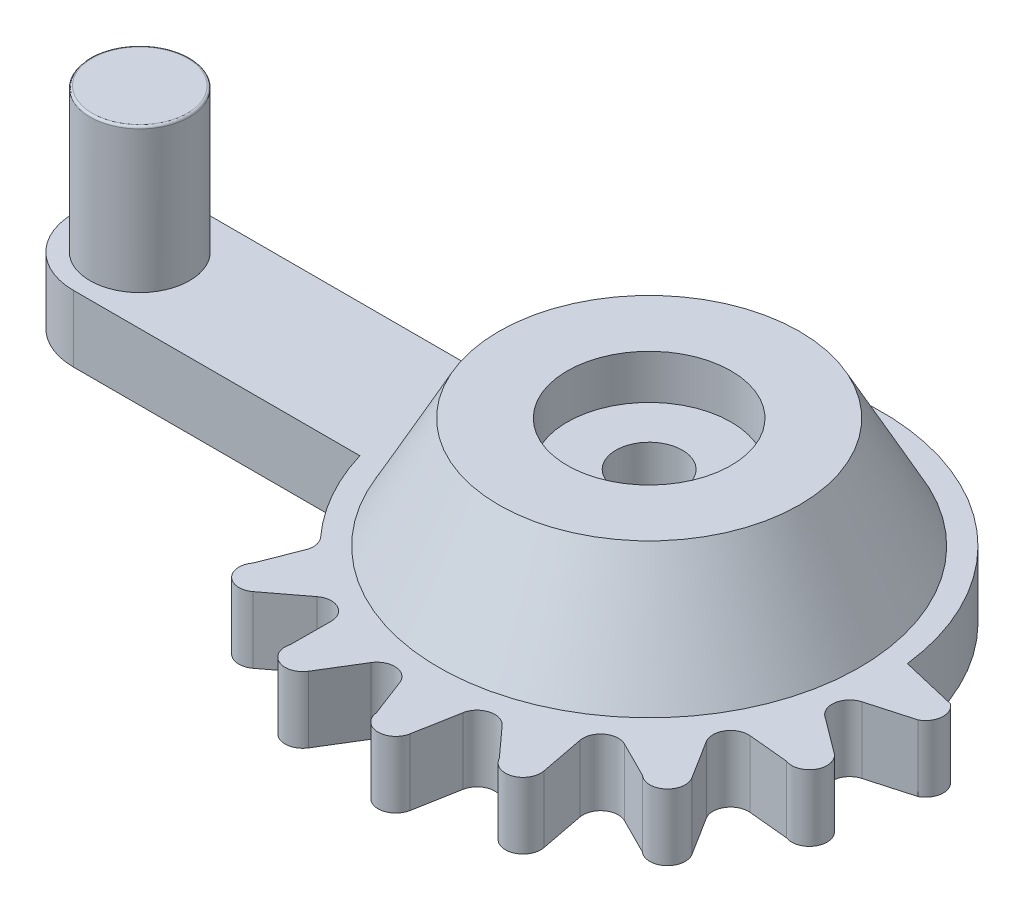
from build123d import *

# Parameters (mm, degrees)
BOSS_EXTRUDE1_DEPTH = 3
BOSS_EXTRUDE2_DEPTH = 3
SKETCH3_R           = 2.25
BOSS_EXTRUDE3_DEPTH = 6.5
FILLET1_R           = 0.1
SKETCH6_R           = 1.5
CUT_EXTRUDE3_DEPTH  = 30.962406787
SKETCH7_R           = 2.25
CUT_EXTRUDE4_DEPTH  = 0.6
SKETCH8_R           = 0.75
CUT_EXTRUDE5_DEPTH  = 7


# Read off the part's stored shape, not the designer's step: Boss-Extrude2
with BuildPart() as part:
    # Sketch1 → Boss-Extrude1 (new body)
    with BuildSketch(Plane(origin=(0, 0, 0), x_dir=(1, 0, 0), z_dir=(0, 1, 0))):
        with BuildLine():
            Line((-23, 3), (-10.062305899, 3))
            ThreePointArc((-10.062305899, 3), (10.5, 0), (-10.062305899, -3))
            Line((-10.062305899, -3), (-23, -3))
            ThreePointArc((-23, -3), (-26, 0), (-23, 3))
        make_face()
    extrude(amount=BOSS_EXTRUDE1_DEPTH)

    # Boss-Extrude2 outline → Boss-Extrude2 (add)
    with BuildSketch(Plane(origin=(0, 0, 0), x_dir=(1, 0, 0), z_dir=(0, 1, 0))):
        with BuildLine():
            ThreePointArc((-5.522818211, -9.478178454), (-5.113524662, -9.318232563), (-4.681499231, -9.398593775))
            ThreePointArc((-4.681499231, -9.398593775), (-6.330495099, -8.377041948), (-7.763435591, -7.069587529))
            ThreePointArc((-7.763435591, -7.069587529), (-7.568178787, -7.463260843), (-7.61030601, -7.900672771))
            Line((-7.61030601, -7.900672771), (-8.279523298, -9.604618361))
            ThreePointArc((-8.279523298, -9.604618361), (-8.203196552, -10.651208986), (-7.156206429, -10.721844617))
            Line((-7.156206429, -10.721844617), (-5.522818211, -9.478178454))
        make_face()
        with BuildLine():
            ThreePointArc((-1.721512659, -10.833918126), (-1.397763446, -10.536788435), (-0.965920838, -10.455476887))
            ThreePointArc((-0.965920838, -10.455476887), (-2.872731946, -10.099376771), (-4.681499231, -9.398593775))
            ThreePointArc((-4.681499231, -9.398593775), (-4.357094721, -9.695015118), (-4.238192033, -10.118058909))
            Line((-4.238192033, -10.118058909), (-4.245930648, -11.948693352))
            ThreePointArc((-4.245930648, -11.948693352), (-3.796296521, -12.896853076), (-2.79461913, -12.584091002))
            Line((-2.79461913, -12.584091002), (-1.721512659, -10.833918126))
        make_face()
        with BuildLine():
            ThreePointArc((2.312803759, -10.723261005), (2.507193937, -10.329163724), (2.880407716, -10.097190272))
            ThreePointArc((2.880407716, -10.097190272), (0.973862068, -10.454740201), (-0.965920838, -10.455476887))
            ThreePointArc((-0.965920838, -10.455476887), (-0.556271486, -10.614522786), (-0.292428604, -10.965941515))
            Line((-0.292428604, -10.965941515), (0.362358895, -12.675484051))
            ThreePointArc((0.362358895, -12.675484051), (1.124441346, -13.396877181), (1.945226568, -12.7430505))
            Line((1.945226568, -12.7430505), (2.312803759, -10.723261005))
        make_face()
        with BuildLine():
            ThreePointArc((6.034076643, -9.161184796), (6.072796451, -8.723461012), (6.336866889, -8.372223004))
            ThreePointArc((6.336866889, -8.372223004), (4.688647545, -9.39502976), (2.880407716, -10.097190272))
            ThreePointArc((2.880407716, -10.097190272), (3.319847778, -10.097333864), (3.692915739, -10.329557645))
            Line((3.692915739, -10.329557645), (4.921602293, -11.686617593))
            ThreePointArc((4.921602293, -11.686617593), (5.892983381, -12.083601839), (6.421781187, -11.177207559))
            Line((6.421781187, -11.177207559), (6.034076643, -9.161184796))
        make_face()
        with BuildLine():
            ThreePointArc((8.938622786, -6.359120261), (8.816430498, -5.937014916), (8.935616531, -5.514050889))
            ThreePointArc((8.935616531, -5.514050889), (7.768814222, -7.063676492), (6.336866889, -8.372223004))
            ThreePointArc((6.336866889, -8.372223004), (6.746618445, -8.213446044), (7.178415082, -8.295043382))
            Line((7.178415082, -8.295043382), (8.814695021, -9.115939424))
            ThreePointArc((8.814695021, -9.115939424), (9.863895986, -9.134782017), (10.029132325, -8.098502778))
            Line((10.029132325, -8.098502778), (8.938622786, -6.359120261))
        make_face()
        with BuildLine():
            ThreePointArc((10.633304904, -2.696333552), (10.366740607, -2.346987899), (10.324902114, -1.909553962))
            ThreePointArc((10.324902114, -1.909553962), (9.797448349, -3.776242293), (8.935616531, -5.514050889))
            ThreePointArc((8.935616531, -5.514050889), (9.260219543, -5.217846902), (9.692298733, -5.13777511))
            Line((9.692298733, -5.13777511), (11.514697643, -5.311396998))
            ThreePointArc((11.514697643, -5.311396998), (12.499706621, -4.949547548), (12.279016357, -3.923646229))
            Line((12.279016357, -3.923646229), (10.633304904, -2.696333552))
        make_face()
        with BuildLine():
            Line((12.95822192, 0.637416485), (10.427354789, 1.23299315))
            ThreePointArc((10.427354789, 1.23299315), (10.49442434, -0.342137064), (10.324902114, -1.909553962))
            ThreePointArc((10.324902114, -1.909553962), (10.520420766, -1.516004291), (10.894306512, -1.285096658))
            Line((10.894306512, -1.285096658), (12.870116963, -0.727570251))
            ThreePointArc((12.870116963, -0.727570251), (13.298325237, -0.06987275), (12.95822192, 0.637416485))
        make_face()
    extrude(amount=BOSS_EXTRUDE2_DEPTH)

    # Sketch5 → Revolve1 (revolve)
    with BuildSketch(Plane.XY, mode=Mode.PRIVATE) as revolve1_sk:
        Polygon((-3.7, 8), (-6.789097331, 8), (-9.5, 3), (-1.5, 3), (-1.5, 6), (-3.7, 6), align=None)
    revolve(revolve1_sk.sketch.rotate(Axis((0, 0, 0), (0, 1, 0)), 270), axis=Axis((0, 0, 0), (0, 1, 0)))

    # Sketch3 → Boss-Extrude3 (add)
    with BuildSketch(Plane(origin=(0, 3, 0), x_dir=(1, 0, 0), z_dir=(0, 1, 0))):
        with Locations(Location((-23, 0, 0), (0, 0, 90))):
            Circle(SKETCH3_R)
    extrude(amount=BOSS_EXTRUDE3_DEPTH)

    # Fillet1
    fillet1_edges = [part.edges().sort_by_distance(p)[0] for p in [
        (-23, 9.5, 2.25),
    ]]
    fillet(fillet1_edges, radius=FILLET1_R)

    # Sketch6 → Cut-Extrude3 (cut, through all)
    with BuildSketch(Plane(origin=(0, 3, 0), x_dir=(1, 0, 0), z_dir=(0, 1, 0))):
        with Locations(Location((0, 0, 0), (0, 0, 90))):
            Circle(SKETCH6_R)
    extrude(amount=-CUT_EXTRUDE3_DEPTH, mode=Mode.SUBTRACT)

    # Sketch7 → Cut-Extrude4 (cut)
    with BuildSketch(Plane(origin=(0, 0, 0), x_dir=(1, 0, 0), z_dir=(0, 1, 0))):
        with Locations(Location((-23, 0, 0), (0, 0, 90))):
            Circle(SKETCH7_R)
    extrude(amount=CUT_EXTRUDE4_DEPTH, mode=Mode.SUBTRACT)

    # Sketch8 → Cut-Extrude5 (cut)
    with BuildSketch(Plane.XZ.offset(-0.6)):
        with Locations(Location((-23, 0, 0), (0, 0, 270))):
            Circle(SKETCH8_R)
    extrude(amount=-CUT_EXTRUDE5_DEPTH, mode=Mode.SUBTRACT)


solid = part.part
